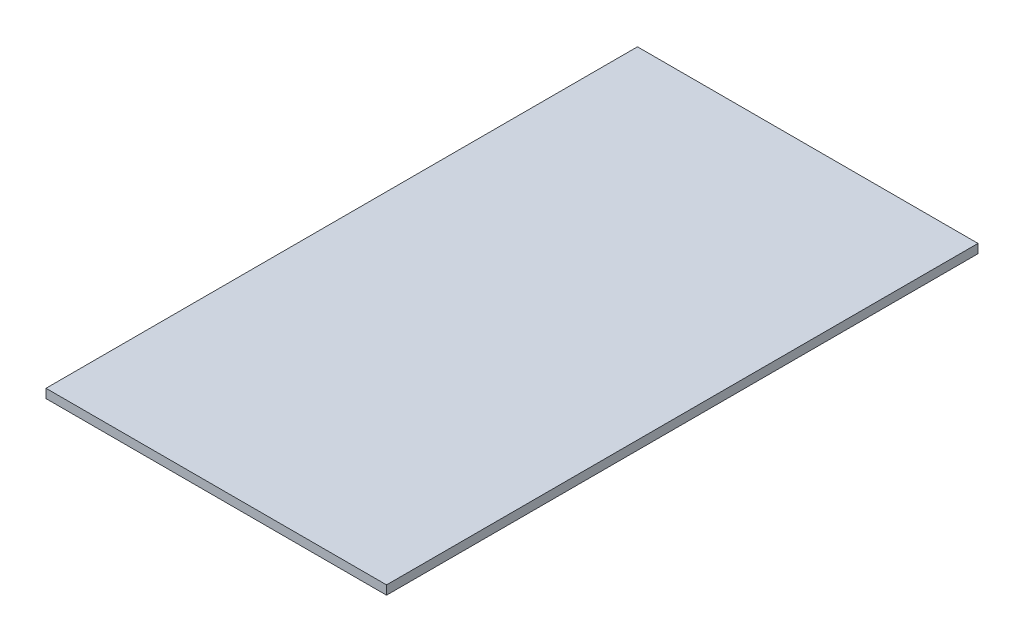
from build123d import *

# Parameters (mm, degrees)
SKETCH1_W           = 38
SKETCH1_H           = 66
BOSS_EXTRUDE1_DEPTH = 1


with BuildPart() as part:
    # Sketch1 → Boss-Extrude1 (new body)
    with BuildSketch(Plane(origin=(0, 0, 0), x_dir=(1, 0, 0), z_dir=(0, 1, 0))):
        with Locations((19, 33)):
            Rectangle(SKETCH1_W, SKETCH1_H)
    extrude(amount=BOSS_EXTRUDE1_DEPTH)


solid = part.part
